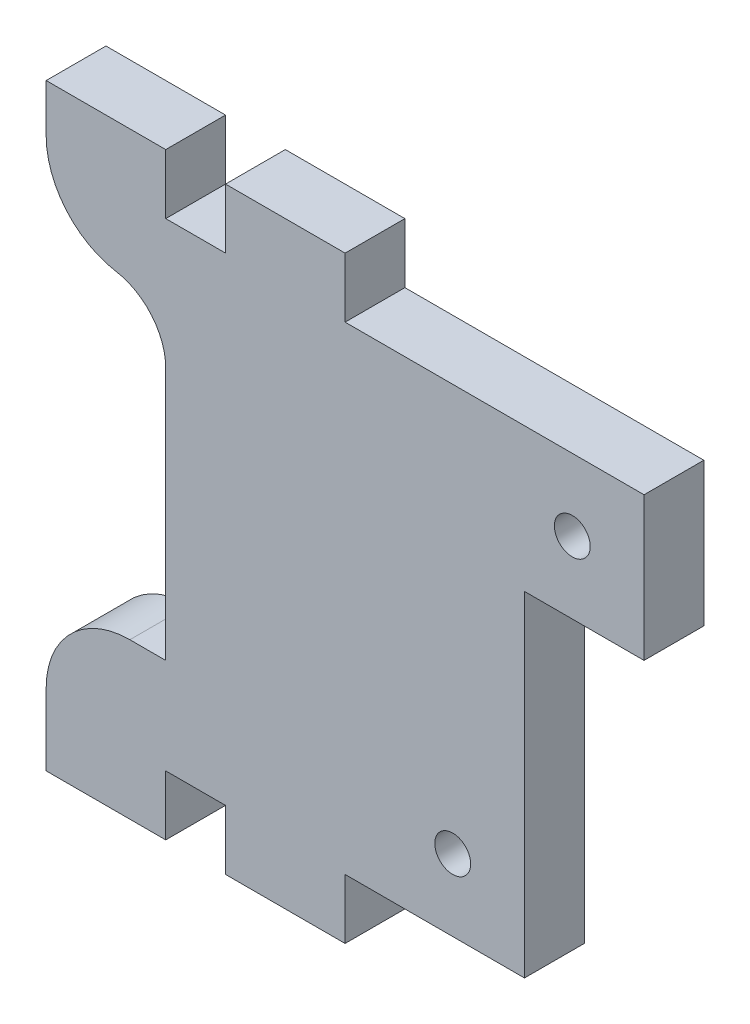
from build123d import *

# Parameters (mm, degrees)
ESQUISSE1_R        = 1.5
BOSS_EXTRU_1_DEPTH = 5
CONG_1_R           = 7
CONG_2_R           = 5


with BuildPart() as part:
    # Esquisse1 → Boss.-Extru.1 (new body)
    with BuildSketch(Plane.XY):
        Polygon((10, 0), (15, 0), (15, -5), (25, -5), (25, 0), (40, 0), (40, 28), (50, 28), (50, 40), (25, 40), (25, 45), (15, 45), (15, 40), (10, 40), (10, 45), (0, 45), (0, 40), (0, 34), (10, 34), (10, 8), (0, 8), (0, 0), (0, -5), (10, -5), align=None)
        with Locations((44, 34)):
            Circle(ESQUISSE1_R, mode=Mode.SUBTRACT)
        with Locations((34, 6)):
            Circle(ESQUISSE1_R, mode=Mode.SUBTRACT)
    extrude(amount=BOSS_EXTRU_1_DEPTH)

    # Congé1
    cong_1_edges = [part.edges().sort_by_distance(p)[0] for p in [
        (0, 8, 2.5),
        (0, 34, 2.5),
    ]]
    fillet(cong_1_edges, radius=CONG_1_R)

    # Congé2
    cong_2_edges = [part.edges().sort_by_distance(p)[0] for p in [
        (10, 34, 2.5),
    ]]
    fillet(cong_2_edges, radius=CONG_2_R)


solid = part.part
